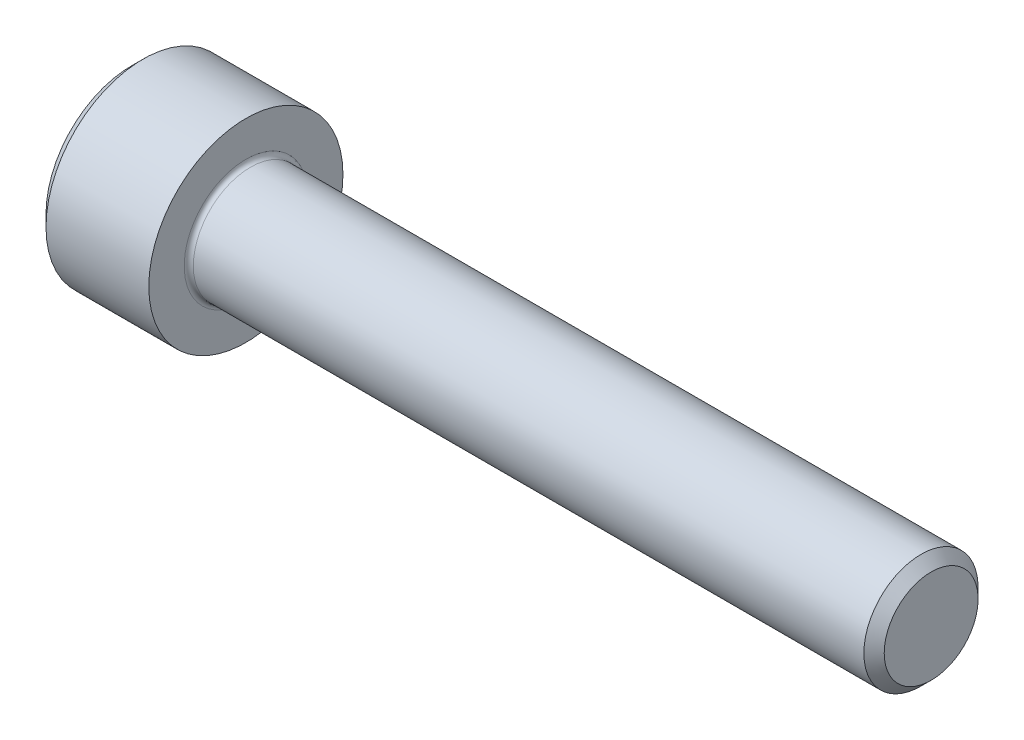
from build123d import *

# Parameters (mm, degrees)
FILLET1_R   = 0.2
HEX_2_DEPTH = 2.5


with BuildPart() as part:
    # BodySke → Base-Revolve (revolve)
    with BuildSketch(Plane.XY):
        Polygon((0, 0), (0, 3.75), (0.5, 4.25), (5, 4.25), (5, 2.5), (34.555, 2.5), (35, 2.055), (35, 0), align=None)
    revolve(axis=Axis((-31.75, 0, 0), (1, 0, 0)))

    # Fillet1
    fillet1_edges = [part.edges().sort_by_distance(p)[0] for p in [
        (5, -2.5, 0),
    ]]
    fillet(fillet1_edges, radius=FILLET1_R)

    # Sketch2 → Hex-PreBroach (revolve, cut)
    with BuildSketch(Plane.XY):
        Polygon((0, 2.042), (2.5, 2.042), (3.67894925, 0), (0, 0), align=None)
    revolve(axis=Axis((0, 0, 0), (1, 0, 0)), mode=Mode.SUBTRACT)

    # Sketch3 → Hex 2 (cut)
    with BuildSketch(Plane(origin=(0, 0, 0), x_dir=(0, 0.500000000000001, 0.866025403784438), z_dir=(-1, 0, 0))):
        Polygon((1.17894925, 2.042), (-1.17894925, 2.042), (-2.357898499, 0), (-1.17894925, -2.042), (1.17894925, -2.042), (2.357898499, 0), align=None)
    extrude(amount=-HEX_2_DEPTH, mode=Mode.SUBTRACT)


solid = part.part
